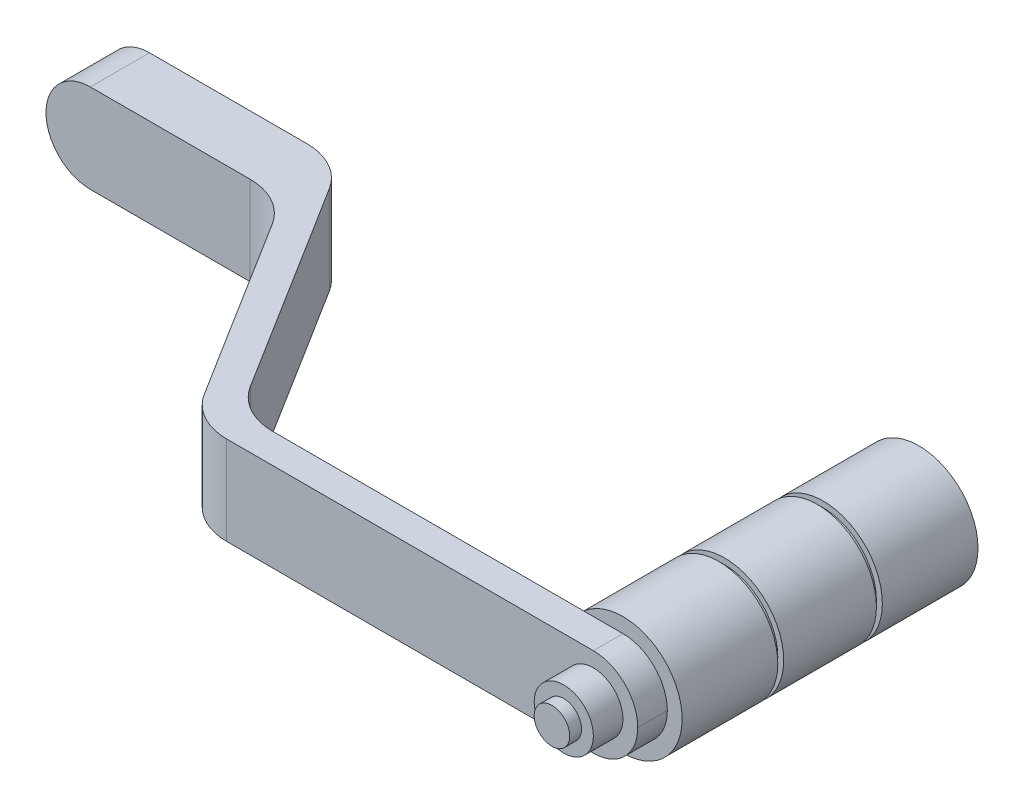
from build123d import *

# Parameters (mm, degrees)
BOSS_EXTRUDE1_DEPTH    = 9.525
FILLET1_R              = 9.525
FILLET2_R              = 12.7
SKETCH2_R              = 12.7
BOSS_EXTRUDE2_DEPTH    = 63.5
SKETCH4_R              = 12.7
SKETCH4_R_2            = 11.43
CUT_EXTRUDE1_DEPTH     = 0.635
LPATTERN1_COUNT        = 2
LPATTERN1_PITCH        = 21.166666667
SKETCH5_R              = 6.35
BOSS_EXTRUDE3_DEPTH    = 6.35
SKETCH6_R              = 3.81
BOSS_EXTRUDE4_DEPTH    = 2.54
CUT_EXTRUDE2_START     = -1
CUT_EXTRUDE2_OUTLINE_W = 6.477
CUT_EXTRUDE2_OUTLINE_H = 5.588
CUT_EXTRUDE2_DEPTH     = 4.2385
CUT_EXTRUDE2_START_2   = -2.794
CUT_EXTRUDE2_2_DEPTH   = 5.588


with BuildPart() as part:
    # Sketch1 → Boss-Extrude1 (new, symmetric)
    with BuildSketch(Plane(origin=(0, 0, 0), x_dir=(1, 0, 0), z_dir=(0, 1, 0))):
        Polygon((0, -6.35), (0, 6.35), (50.350722524, 6.35), (86.069472524, -50.8), (177.8, -50.8), (177.8, -57.15), (82.55, -57.15), (50.8, -6.35), align=None)
    extrude(amount=BOSS_EXTRUDE1_DEPTH, both=True)

    # Fillet1
    fillet1_edges = [part.edges().sort_by_distance(p)[0] for p in [
        (177.8, -9.525, 53.975),
        (177.8, 9.525, 53.975),
        (0, -9.525, 0),
        (0, 9.525, 0),
    ]]
    fillet(fillet1_edges, radius=FILLET1_R - 0.0001)  # a hair under: the kernel refuses the full size

    # Fillet2
    fillet2_edges = [part.edges().sort_by_distance(p)[0] for p in [
        (50.350722524, 0, -6.35),
        (86.069472524, 0, 50.8),
        (82.55, 0, 57.15),
        (50.8, 0, 6.35),
    ]]
    fillet(fillet2_edges, radius=FILLET2_R)

    # Sketch2 → Boss-Extrude2 (add)
    with BuildSketch(Plane(origin=(0, 0, 50.8), x_dir=(-1, 0, 0), z_dir=(0, 0, -1))):
        with Locations(Location((-168.275, 0, 0), (0, 0, 180))):
            Circle(SKETCH2_R)
    extrude(amount=BOSS_EXTRUDE2_DEPTH)

    # Sketch4 → Cut-Extrude1 (cut, symmetric)
    with BuildSketch(Plane.XY.offset(29.633333333)):
        with Locations((168.275, 0)):
            Circle(SKETCH4_R)
        with Locations((168.275, 0)):
            Circle(SKETCH4_R_2, mode=Mode.SUBTRACT)
    cut_extrude1 = extrude(amount=CUT_EXTRUDE1_DEPTH, both=True, mode=Mode.SUBTRACT)

    # LPattern1: Cut-Extrude1 ×2
    with Locations(*[(0, 0, -i * LPATTERN1_PITCH) for i in range(1, LPATTERN1_COUNT)]):
        add(cut_extrude1, mode=Mode.SUBTRACT)

    # Sketch5 → Boss-Extrude3 (add)
    with BuildSketch(Plane.XY.offset(57.15)):
        with Locations(Location((168.275, 0, 0), (0, 0, 180))):
            Circle(SKETCH5_R)
    extrude(amount=BOSS_EXTRUDE3_DEPTH)

    # Sketch6 → Boss-Extrude4 (add)
    with BuildSketch(Plane.XY.offset(63.5)):
        with Locations((168.275, 0)):
            Circle(SKETCH6_R)
    extrude(amount=BOSS_EXTRUDE4_DEPTH)

    # Cut-Extrude2: read off the stored shape, not the designer's step
    # Cut-Extrude2 outline → Cut-Extrude2 (cut)
    with BuildSketch(Plane.YZ.offset(CUT_EXTRUDE2_START)):
        Rectangle(CUT_EXTRUDE2_OUTLINE_W, CUT_EXTRUDE2_OUTLINE_H)
    extrude(amount=CUT_EXTRUDE2_DEPTH, mode=Mode.SUBTRACT)

    # Cut-Extrude2 2 outline → Cut-Extrude2 2 (cut)
    with BuildSketch(Plane.XY.offset(CUT_EXTRUDE2_START_2)):
        Polygon((9.496069796, -2.159), (9.496069796, 2.159), (3.2385, 3.2385), (3.2385, -3.2385), align=None)
    extrude(amount=CUT_EXTRUDE2_2_DEPTH, mode=Mode.SUBTRACT)


solid = part.part
